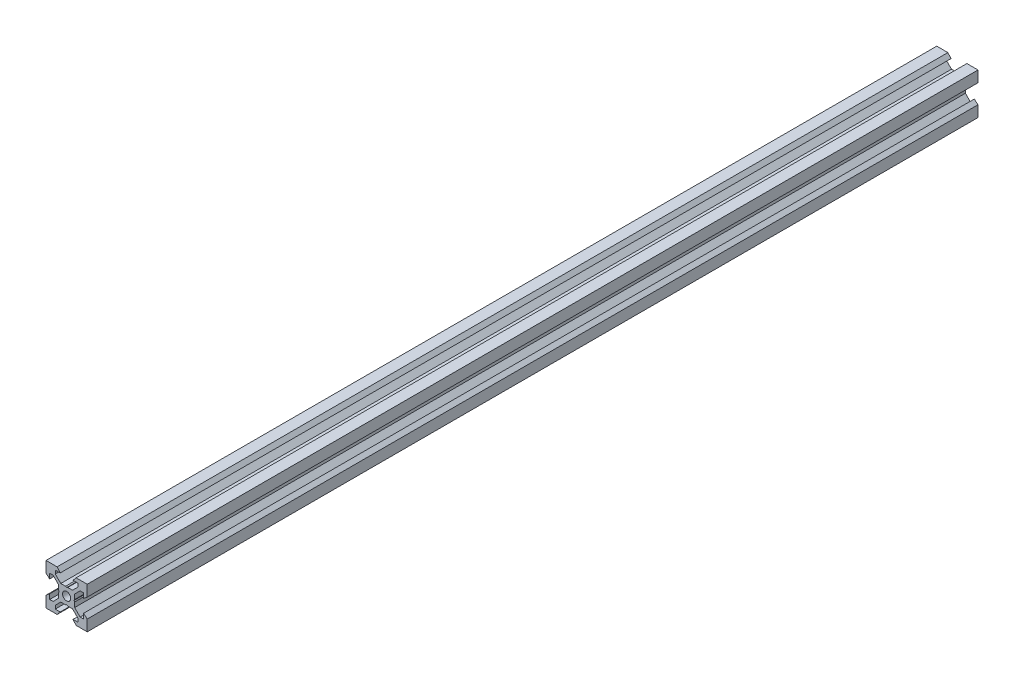
from build123d import *

# Parameters (mm, degrees)
SKETCH1_R           = 2
BOSS_EXTRUDE1_DEPTH = 216


with BuildPart() as part:
    # Sketch1 → Boss-Extrude1 (new, symmetric)
    with BuildSketch(Plane.XY):
        Polygon((10, 4.610379336), (10, 10), (4.610379336, 10), (3.1, 8.2), (5.5, 8.2), (5.5, 6.560660172), (2.839339828, 3.9), (0.519615242, 3.9), (0, 3.6), (-0.519615242, 3.9), (-2.839339828, 3.9), (-5.5, 6.560660172), (-5.5, 8.2), (-3.1, 8.2), (-4.610379336, 10), (-10, 10), (-10, 4.610379336), (-8.2, 3.1), (-8.2, 5.5), (-6.560660172, 5.5), (-3.9, 2.839339828), (-3.9, 0.519615242), (-3.6, 0), (-3.9, -0.519615242), (-3.9, -2.839339828), (-6.560660172, -5.5), (-8.2, -5.5), (-8.2, -3.1), (-10, -4.610379336), (-10, -10), (-4.610379336, -10), (-3.1, -8.2), (-5.5, -8.2), (-5.5, -6.560660172), (-2.839339828, -3.9), (-0.519615242, -3.9), (0, -3.6), (0.519615242, -3.9), (2.839339828, -3.9), (5.5, -6.560660172), (5.5, -8.2), (3.1, -8.2), (4.610379336, -10), (10, -10), (10, -4.610379336), (8.2, -3.1), (8.2, -5.5), (6.560660172, -5.5), (3.9, -2.839339828), (3.9, -0.519615242), (3.6, 0), (3.9, 0.519615242), (3.9, 2.839339828), (6.560660172, 5.5), (8.2, 5.5), (8.2, 3.1), align=None)
        Circle(SKETCH1_R, mode=Mode.SUBTRACT)
    extrude(amount=BOSS_EXTRUDE1_DEPTH, both=True)


solid = part.part
